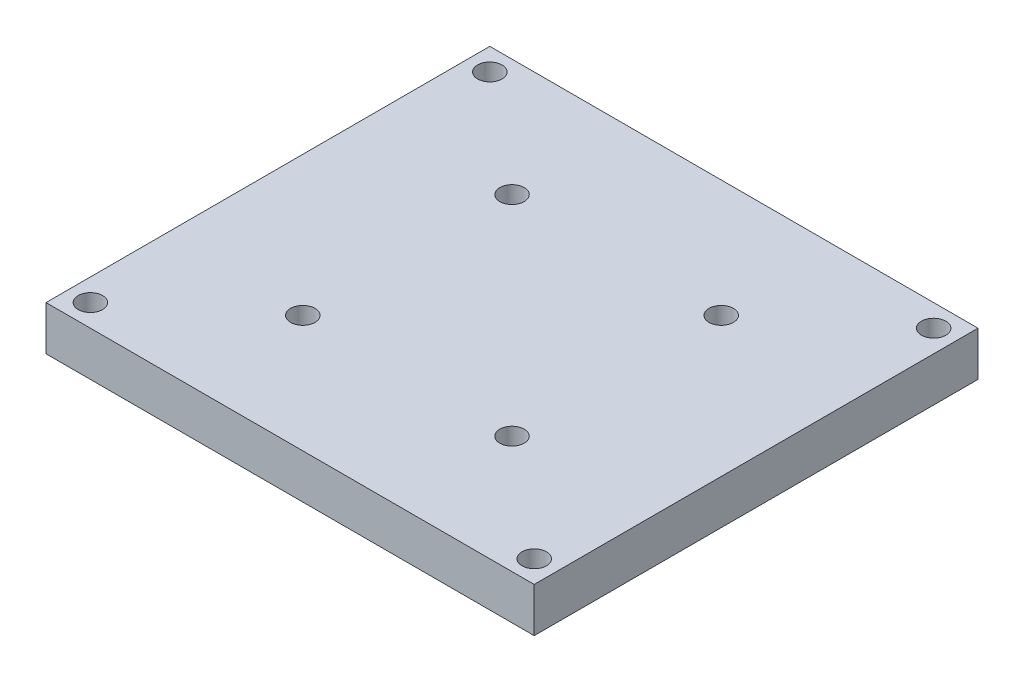
from build123d import *

# Parameters (mm, degrees)
SKETCH2_W           = 110
SKETCH2_H           = 100
SKETCH2_R           = 2.75
BOSS_EXTRUDE1_DEPTH = 10


with BuildPart() as part:
    # Sketch2 → Boss-Extrude1 (new body)
    with BuildSketch(Plane(origin=(0, 0, 0), x_dir=(1, 0, 0), z_dir=(0, 1, 0))):
        with Locations((23.57, 23.57)):
            Rectangle(SKETCH2_W, SKETCH2_H)
        Circle(SKETCH2_R, mode=Mode.SUBTRACT)
        with Locations((0, 47.14)):
            Circle(SKETCH2_R, mode=Mode.SUBTRACT)
        with Locations((47.14, 47.14)):
            Circle(SKETCH2_R, mode=Mode.SUBTRACT)
        with Locations((47.14, 0)):
            Circle(SKETCH2_R, mode=Mode.SUBTRACT)
        with Locations((73.57, 68.57)):
            Circle(SKETCH2_R, mode=Mode.SUBTRACT)
        with Locations((73.57, -21.43)):
            Circle(SKETCH2_R, mode=Mode.SUBTRACT)
        with Locations((-26.43, -21.43)):
            Circle(SKETCH2_R, mode=Mode.SUBTRACT)
        with Locations((-26.43, 68.57)):
            Circle(SKETCH2_R, mode=Mode.SUBTRACT)
    extrude(amount=BOSS_EXTRUDE1_DEPTH)


solid = part.part
